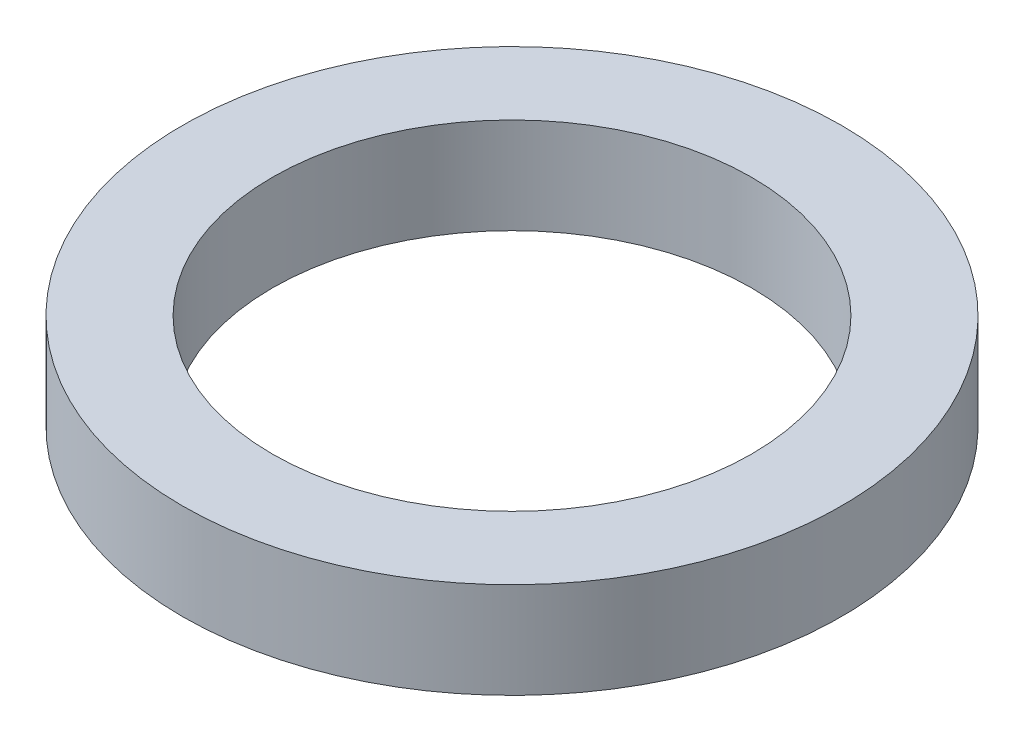
from build123d import *

# Parameters (mm, degrees)
SKETCH1_R           = 27.5
BOSS_EXTRUDE1_DEPTH = 8
SKETCH2_R           = 20
CUT_EXTRUDE1_DEPTH  = 40.705163392


with BuildPart() as part:
    # Sketch1 → Boss-Extrude1 (new body)
    with BuildSketch(Plane(origin=(0, 0, 0), x_dir=(1, 0, 0), z_dir=(0, 1, 0))):
        Circle(SKETCH1_R)
    extrude(amount=BOSS_EXTRUDE1_DEPTH)

    # Sketch2 → Cut-Extrude1 (cut, through all)
    with BuildSketch(Plane(origin=(0, 0, 0), x_dir=(1, 0, 0), z_dir=(0, 1, 0))):
        Circle(SKETCH2_R)
    extrude(amount=CUT_EXTRUDE1_DEPTH, mode=Mode.SUBTRACT)


solid = part.part
